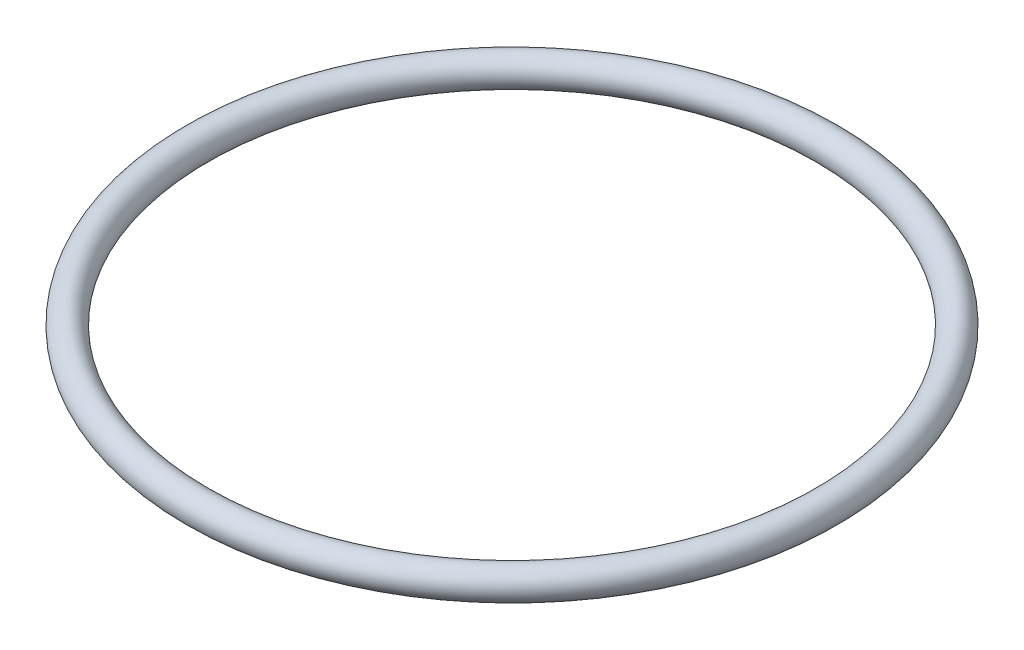
from build123d import *

# Parameters (mm, degrees)
SKETCH1_R = 3.4925


with BuildPart() as part:
    # Sketch1 → Revolve1 (revolve)
    with BuildSketch(Plane.XY):
        with Locations((-73.025, 0)):
            Circle(SKETCH1_R)
    revolve(axis=Axis((0, -3.4925, 0), (0, 1, 0)))


solid = part.part
